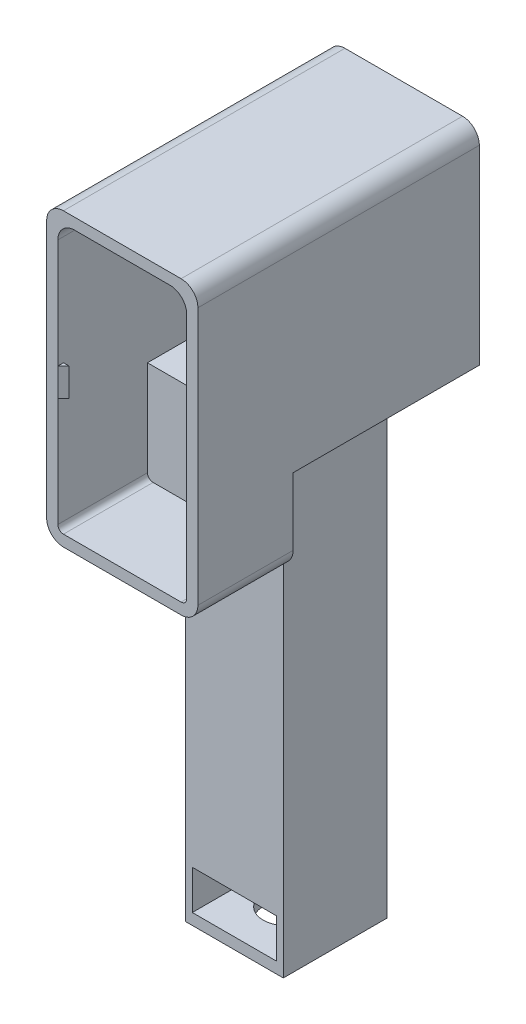
from build123d import *

# Parameters (mm, degrees)
SKETCH1_W                = 20
SKETCH1_H                = 20
SKETCH1_R                = 4
SKETCH1_H_2              = 10
BOSS_EXTRUDE2_DEPTH      = 2
SKETCH2_W                = 45
SKETCH2_H                = 60
SKETCH2_W_2              = 43
SKETCH2_H_2              = 58
BOSS_EXTRUDE3_DEPTH      = 4
SKETCH6_W                = 45
SKETCH6_H                = 30
BOSS_EXTRUDE4_DEPTH      = 2
CUT_EXTRUDE4_DEPTH       = 4
BOSS_EXTRUDE5_DEPTH      = 7
BOSS_EXTRUDE5_2_DEPTH    = 7
BOSS_EXTRUDE5_3_DEPTH    = 7
SKETCH11_W               = 19
SKETCH11_H               = 19
BOSS_EXTRUDE6_DEPTH      = 2
SKETCH14_R               = 4
CUT_EXTRUDE7_DEPTH       = 19
SKETCH15_W               = 1
SKETCH15_H               = 17
SKETCH15_H_2             = 1
BOSS_EXTRUDE7_DEPTH      = 80
SKETCH16_W               = 16.5
SKETCH16_H               = 16.5
BOSS_EXTRUDE8_DEPTH      = 80
SKETCH17_R               = 4
CUT_EXTRUDE8_DEPTH       = 193
SKETCH18_W               = 105.72576136
SKETCH18_H               = 91
CUT_EXTRUDE9_DEPTH       = 193
SKETCH19_W               = 10.5
SKETCH19_H               = 2
CUT_EXTRUDE10_DEPTH      = 193
SKETCH20_W               = 16.5
SKETCH20_H               = 16.5
SKETCH20_R               = 4
BOSS_EXTRUDE10_DEPTH     = 80
SKETCH21_W               = 16.5
SKETCH21_H               = 16.5
SKETCH21_R               = 4
CUT_EXTRUDE11_DEPTH      = 80
SKETCH22_W               = 14
SKETCH22_H               = 5
CUT_EXTRUDE12_DEPTH      = 16
SKETCH24_W               = 16.5
SKETCH24_H               = 80
SKETCH24_W_2             = 14
SKETCH24_H_2             = 5
BOSS_EXTRUDE11_DEPTH     = 2
SKETCH25_R               = 4.1
SKETCH25_R_2             = 4
CUT_EXTRUDE14_DEPTH      = 103
SKETCH26_W               = 35
SKETCH26_H               = 40
BOSS_EXTRUDE12_DEPTH     = 5
SKETCH27_W               = 23
SKETCH27_H               = 5.75
CUT_EXTRUDE17_DEPTH      = 5
SKETCH28_W               = 2
SKETCH28_H               = 40
BOSS_EXTRUDE13_DEPTH     = 32
SKETCH29_W               = 4
SKETCH29_H               = 40
CUT_EXTRUDE18_DEPTH      = 32
SKETCH30_W               = 4
SKETCH30_H               = 40
CUT_EXTRUDE19_DEPTH      = 32
SKETCH31_W               = 10
SKETCH31_H               = 2
CUT_EXTRUDE20_DEPTH      = 32
SKETCH34_W               = 44.25
SKETCH34_H               = 2
BOSS_EXTRUDE15_DEPTH     = 23
FILLET1_R                = 3
FILLET2_R                = 3
FILLET3_R                = 3
FILLET4_R                = 3
BOSS_EXTRUDE16_DEPTH     = 20
SKETCH36_W               = 10
SKETCH36_H               = 2
BOSS_EXTRUDE17_DEPTH     = 23
SKETCH37_W               = 27
SKETCH37_H               = 20
CUT_EXTRUDE23_DEPTH      = 1
SKETCH42_W               = 1
SKETCH42_H               = 5
BOSS_EXTRUDE22_DEPTH     = 2
SKETCH44_W               = 1
SKETCH44_H               = 2
BOSS_EXTRUDE23_DEPTH     = 2
SKETCH46_W               = 1
SKETCH46_H               = 2
BOSS_EXTRUDE24_DEPTH     = 3
SKETCH47_W               = 16.5
SKETCH47_H               = 18.5
SKETCH47_R               = 4.1
BOSS_EXTRUDE25_DEPTH     = 2
SKETCH50_W               = 14
SKETCH50_H               = 18
SKETCH50_R               = 4.1
CUT_EXTRUDE26_DEPTH      = 2
SKETCH51_W               = 18
SKETCH51_H               = 7
CUT_EXTRUDE27_DEPTH      = 0.5
SKETCH52_W               = 18
SKETCH52_H               = 7
CUT_EXTRUDE28_DEPTH      = 0.5
SKETCH53_W               = 18.5
SKETCH53_H               = 82
BOSS_EXTRUDE26_DEPTH     = 0.5
SKETCH54_W               = 18.5
SKETCH54_H               = 82
BOSS_EXTRUDE27_DEPTH     = 0.5
BOSS_EXTRUDE30_DEPTH     = 5
CUT_EXTRUDE31_REACH      = 138.104
SKETCH61_W               = 23
SKETCH61_H               = 5
CUT_EXTRUDE32_DEPTH      = 25
CUT_EXTRUDE32_DEPTH_BACK = 5
SKETCH62_W               = 6.75
SKETCH62_H               = 5
BOSS_EXTRUDE31_DEPTH     = 10.25
BOSS_EXTRUDE32_DEPTH     = 6
SKETCH65_W               = 23
SKETCH65_H               = 2
BOSS_EXTRUDE33_DEPTH     = 6
FILLET5_R                = 3
FILLET6_R                = 3
FILLET7_R                = 1
FILLET8_R                = 1
SKETCH66_W               = 1
SKETCH66_H               = 1
CUT_EXTRUDE33_DEPTH      = 5
BOSS_EXTRUDE34_DEPTH     = 6
SKETCH68_W               = 17
SKETCH68_H               = 15
BOSS_EXTRUDE35_DEPTH     = 6
BOSS_EXTRUDE37_DEPTH     = 15
SKETCH72_W               = 3
SKETCH72_H               = 15
BOSS_EXTRUDE38_DEPTH     = 3


# Read off the part's stored shape, not the designer's step: Boss-Extrude16, Boss-Extrude32
with BuildPart() as part:
    # Sketch1 → Boss-Extrude2 (new body)
    # profile 1 of 6: a face of its own
    with BuildSketch(Plane(origin=(0, 0, 0), x_dir=(1, 0, 0), z_dir=(0, 1, 0))):
        Polygon((-22.5, 10), (-10, 10), (10, 10), (22.5, 10), (22.5, 70), (-22.5, 70), align=None)
    # profile 2 of 6: a face of its own
    with BuildSketch(Plane(origin=(0, 0, 0), x_dir=(1, 0, 0), z_dir=(0, 1, 0))):
        Polygon((-22.5, 10), (-10, -10), (-10, 10), align=None)
    # profile 3 of 6: a face of its own
    with BuildSketch(Plane(origin=(0, 0, 0), x_dir=(1, 0, 0), z_dir=(0, 1, 0))):
        Polygon((10, 10), (10, -10), (22.5, 10), align=None)
    # profile 4 of 6: a face of its own
    with BuildSketch(Plane(origin=(0, 0, 0), x_dir=(1, 0, 0), z_dir=(0, 1, 0))):
        Rectangle(SKETCH1_W, SKETCH1_H)
        Circle(SKETCH1_R, mode=Mode.SUBTRACT)
    # profile 5 of 6: a face of its own
    with BuildSketch(Plane(origin=(0, 0, 0), x_dir=(1, 0, 0), z_dir=(0, 1, 0))):
        Circle(SKETCH1_R)
    # profile 6 of 6: a face of its own
    with BuildSketch(Plane(origin=(0, 0, 0), x_dir=(1, 0, 0), z_dir=(0, 1, 0))):
        with Locations((0, -15)):
            Rectangle(SKETCH1_W, SKETCH1_H_2)
    extrude(amount=BOSS_EXTRUDE2_DEPTH)

    # Sketch2 → Boss-Extrude3 (add)
    with BuildSketch(Plane(origin=(0, 2, 0), x_dir=(1, 0, 0), z_dir=(0, 1, 0))):
        with Locations((0, 40)):
            Rectangle(SKETCH2_W, SKETCH2_H)
        with Locations((0, 40)):
            Rectangle(SKETCH2_W_2, SKETCH2_H_2, mode=Mode.SUBTRACT)
    extrude(amount=BOSS_EXTRUDE3_DEPTH)

    # Sketch6 → Boss-Extrude4 (add)
    with BuildSketch(Plane(origin=(0, 2, 0), x_dir=(1, 0, 0), z_dir=(0, 1, 0))):
        with Locations((0, -5)):
            Rectangle(SKETCH6_W, SKETCH6_H)
    extrude(amount=-BOSS_EXTRUDE4_DEPTH)

    # Sketch7 → Cut-Extrude4 (cut)
    with BuildSketch(Plane(origin=(0, 2, 0), x_dir=(1, 0, 0), z_dir=(0, 1, 0))):
        with BuildLine():
            Line((9.5, 9.5), (-9.5, 9.5))
            Line((-9.5, 9.5), (-9.5, 2.122498999))
            ThreePointArc((-9.5, 2.122498999), (0, 9), (9.5, 2.122498999))
            Line((9.5, 2.122498999), (9.5, 9.5))
        make_face()
        with BuildLine():
            ThreePointArc((-5.267826876, -9.5), (-7.858215886, -7.184532568), (-9.5, -4.122498999))
            Line((-9.5, -4.122498999), (-9.5, -9.5))
            Line((-9.5, -9.5), (-5.267826876, -9.5))
        make_face()
        with BuildLine():
            Line((9.5, -9.5), (9.5, -4.122498999))
            ThreePointArc((9.5, -4.122498999), (7.858215886, -7.184532568), (5.267826876, -9.5))
            Line((5.267826876, -9.5), (9.5, -9.5))
        make_face()
    extrude(amount=-CUT_EXTRUDE4_DEPTH, mode=Mode.SUBTRACT)


with BuildPart() as body_2:
    # Sketch8 → Boss-Extrude5 (new body)
    with BuildSketch(Plane(origin=(0, 2, 0), x_dir=(1, 0, 0), z_dir=(0, 1, 0))):
        with BuildLine():
            Line((9.5, 2.122498999), (9.5, 9.5))
            Line((9.5, 9.5), (-9.5, 9.5))
            Line((-9.5, 9.5), (-9.5, 2.122498999))
            ThreePointArc((-9.5, 2.122498999), (0, 9), (9.5, 2.122498999))
        make_face()
    extrude(amount=BOSS_EXTRUDE5_DEPTH)



with BuildPart() as body_3:
    # Sketch8 → Boss-Extrude5 2 (new body)
    with BuildSketch(Plane(origin=(0, 2, 0), x_dir=(1, 0, 0), z_dir=(0, 1, 0))):
        with BuildLine():
            Line((-9.5, -9.5), (-5.267826876, -9.5))
            ThreePointArc((-5.267826876, -9.5), (-7.858215886, -7.184532568), (-9.5, -4.122498999))
            Line((-9.5, -4.122498999), (-9.5, -9.5))
        make_face()
    extrude(amount=BOSS_EXTRUDE5_2_DEPTH)


with BuildPart() as body_4:
    # Sketch8 → Boss-Extrude5 3 (new body)
    with BuildSketch(Plane(origin=(0, 2, 0), x_dir=(1, 0, 0), z_dir=(0, 1, 0))):
        with BuildLine():
            Line((9.5, -9.5), (9.5, -4.122498999))
            ThreePointArc((9.5, -4.122498999), (7.858215886, -7.184532568), (5.267826876, -9.5))
            Line((5.267826876, -9.5), (9.5, -9.5))
        make_face()
    extrude(amount=BOSS_EXTRUDE5_3_DEPTH)


with BuildPart() as body_2_1:
    add(body_2.part)

    add(body_3.part)  # Boss-Extrude6 merges body 3

    add(body_4.part)  # Boss-Extrude6 merges body 4
    # Sketch11 → Boss-Extrude6 (add)
    with BuildSketch(Plane(origin=(0, 9, 0), x_dir=(1, 0, 0), z_dir=(0, 1, 0))):
        Rectangle(SKETCH11_W, SKETCH11_H)
    extrude(amount=BOSS_EXTRUDE6_DEPTH)


with BuildPart() as cut_extrude7_tool:
    # Sketch14 → Cut-Extrude7 (new body)
    with BuildSketch(Plane.XZ):
        with Locations(Location((0, 1, 0), (0, 0, 270))):
            Circle(SKETCH14_R)
    extrude(amount=-CUT_EXTRUDE7_DEPTH)


with BuildPart() as part_1:
    add(part.part)

    # Cut-Extrude7: cut by cut_extrude7_tool
    add(cut_extrude7_tool.part, mode=Mode.SUBTRACT)


with BuildPart() as body_2_2:
    add(body_2_1.part)

    # Cut-Extrude7: cut by cut_extrude7_tool
    add(cut_extrude7_tool.part, mode=Mode.SUBTRACT)

    # Sketch15 → Boss-Extrude7 (add)
    with BuildSketch(Plane(origin=(0, 11, 0), x_dir=(1, 0, 0), z_dir=(0, 1, 0))):
        Polygon((-8.5, 8.5), (8.5, 8.5), (8.5, 9.5), (-9.5, 9.5), (-9.5, -9.5), (8.5, -9.5), (8.5, -8.5), (-8.5, -8.5), align=None)
        with Locations((9, 0)):
            Rectangle(SKETCH15_W, SKETCH15_H)
        with Locations((9, 9)):
            Rectangle(SKETCH15_W, SKETCH15_H_2)
        with Locations((9, -9)):
            Rectangle(SKETCH15_W, SKETCH15_H_2)
    extrude(amount=BOSS_EXTRUDE7_DEPTH)


with BuildPart() as body_3_2:
    # Sketch16 → Boss-Extrude8 (new body)
    with BuildSketch(Plane(origin=(0, 91, 0), x_dir=(1, 0, 0), z_dir=(0, 1, 0))):
        Rectangle(SKETCH16_W, SKETCH16_H)
    extrude(amount=BOSS_EXTRUDE8_DEPTH)

    # Sketch17 → Cut-Extrude8 (cut)
    with BuildSketch(Plane.XZ):
        with Locations(Location((0, 1, 0), (0, 0, 270))):
            Circle(SKETCH17_R)
    extrude(amount=-CUT_EXTRUDE8_DEPTH, mode=Mode.SUBTRACT)

    # Sketch20 → Boss-Extrude10 (add)
    with BuildSketch(Plane.XZ.offset(-91)):
        Rectangle(SKETCH20_W, SKETCH20_H)
        with Locations(Location((0, 1, 0), (0, 0, 270))):
            Circle(SKETCH20_R, mode=Mode.SUBTRACT)
    extrude(amount=BOSS_EXTRUDE10_DEPTH)

    # Sketch21 → Cut-Extrude11 (cut)
    with BuildSketch(Plane(origin=(0, 171, 0), x_dir=(1, 0, 0), z_dir=(0, 1, 0))):
        Rectangle(SKETCH21_W, SKETCH21_H)
        with Locations(Location((0, -1, 0), (0, 0, 90))):
            Circle(SKETCH21_R, mode=Mode.SUBTRACT)
    extrude(amount=-CUT_EXTRUDE11_DEPTH, mode=Mode.SUBTRACT)

    # Sketch22 → Cut-Extrude12 (cut)
    with BuildSketch(Plane.XY.offset(8.25)):
        with Locations((0, 15.5)):
            Rectangle(SKETCH22_W, SKETCH22_H)
    extrude(amount=-CUT_EXTRUDE12_DEPTH, mode=Mode.SUBTRACT)

    # Sketch24 → Boss-Extrude11 (add)
    with BuildSketch(Plane.XY.offset(8.25)):
        with Locations((0, 51)):
            Rectangle(SKETCH24_W, SKETCH24_H)
        with Locations((0, 15.5)):
            Rectangle(SKETCH24_W_2, SKETCH24_H_2, mode=Mode.SUBTRACT)
    extrude(amount=BOSS_EXTRUDE11_DEPTH)

    # Sketch25 → Cut-Extrude14 (cut)
    with BuildSketch(Plane(origin=(0, 91, 0), x_dir=(1, 0, 0), z_dir=(0, 1, 0))):
        with Locations(Location((0, -1, 0), (0, 0, 270))):
            Circle(SKETCH25_R)
        with Locations((0, -1)):
            Circle(SKETCH25_R_2, mode=Mode.SUBTRACT)
    extrude(amount=-CUT_EXTRUDE14_DEPTH, mode=Mode.SUBTRACT)

    # Sketch26 → Boss-Extrude12 (add)
    with BuildSketch(Plane(origin=(0, 91, 0), x_dir=(1, 0, 0), z_dir=(0, 1, 0))):
        Rectangle(SKETCH26_W, SKETCH26_H)
    extrude(amount=BOSS_EXTRUDE12_DEPTH)

    # Sketch27 → Cut-Extrude17 (cut)
    with BuildSketch(Plane(origin=(0, 96, 0), x_dir=(1, 0, 0), z_dir=(0, 1, 0))):
        with Locations((0, -17.125)):
            Rectangle(SKETCH27_W, SKETCH27_H)
    extrude(amount=-CUT_EXTRUDE17_DEPTH, mode=Mode.SUBTRACT)

    # Sketch28 → Boss-Extrude13 (add)
    with BuildSketch(Plane(origin=(0, 96, 0), x_dir=(1, 0, 0), z_dir=(0, 1, 0))):
        with Locations((12.5, 0)):
            Rectangle(SKETCH28_W, SKETCH28_H)
        with Locations((-12.5, 0)):
            Rectangle(SKETCH28_W, SKETCH28_H)
    extrude(amount=BOSS_EXTRUDE13_DEPTH)

    # Sketch29 → Cut-Extrude18 (cut)
    with BuildSketch(Plane(origin=(0, 96, 0), x_dir=(1, 0, 0), z_dir=(0, 1, 0))):
        with Locations((-15.5, 0)):
            Rectangle(SKETCH29_W, SKETCH29_H)
    extrude(amount=-CUT_EXTRUDE18_DEPTH, mode=Mode.SUBTRACT)

    # Sketch30 → Cut-Extrude19 (cut)
    with BuildSketch(Plane(origin=(0, 96, 0), x_dir=(1, 0, 0), z_dir=(0, 1, 0))):
        with Locations((15.5, 0)):
            Rectangle(SKETCH30_W, SKETCH30_H)
    extrude(amount=-CUT_EXTRUDE19_DEPTH, mode=Mode.SUBTRACT)

    # Sketch31 → Cut-Extrude20 (cut)
    with BuildSketch(Plane(origin=(0, 96, 0), x_dir=(1, 0, 0), z_dir=(0, 1, 0))):
        with Locations((0, 19)):
            Rectangle(SKETCH31_W, SKETCH31_H)
    extrude(amount=-CUT_EXTRUDE20_DEPTH, mode=Mode.SUBTRACT)

    # Sketch34 → Boss-Extrude15 (add)
    with BuildSketch(Plane.ZY.offset(-11.5)):
        with Locations((2.125, 127)):
            Rectangle(SKETCH34_W, SKETCH34_H)
    extrude(amount=BOSS_EXTRUDE15_DEPTH)

    # Fillet1
    fillet1_edges = [body_3_2.edges().sort_by_distance(p)[0] for p in [
        (-13.5, 128, 0),
    ]]
    fillet(fillet1_edges, radius=FILLET1_R)

    # Fillet2
    fillet2_edges = [body_3_2.edges().sort_by_distance(p)[0] for p in [
        (13.5, 128, 0),
    ]]
    fillet(fillet2_edges, radius=FILLET2_R)

    # Fillet3
    # the kernel refuses this fillet: 3 mm, written as the material it adds along each edge
    with BuildSketch(Plane(origin=(-11.5, 126, 27.5), x_dir=(1, 0, 0), z_dir=(0, 0, -1))) as fillet3_piece_1_section:
        with BuildLine():
            CenterArc((FILLET3_R, FILLET3_R), FILLET3_R, 180, 90)
            Line((0, FILLET3_R), (0, 0))
            Line((0, 0), (FILLET3_R, 0))
        make_face()
    fillet3_piece_1 = extrude(amount=47.5, mode=Mode.PRIVATE)
    fillet3_piece_1 = split(fillet3_piece_1, bisect_by=Plane(origin=(-10.759146849, 125.389580611, 24.25), z_dir=(0, 0, -1)), keep=Keep.TOP, mode=Mode.PRIVATE)
    fillet3_piece_1 = split(fillet3_piece_1, bisect_by=Plane(origin=(-11.5, 125.389580611, 22.125), z_dir=(1, 0, 0)), keep=Keep.TOP, mode=Mode.PRIVATE)
    fillet3_piece_1 = split(fillet3_piece_1, bisect_by=Plane(origin=(-10.759146849, 125.389580611, 20), z_dir=(0, 0, 1)), keep=Keep.TOP, mode=Mode.PRIVATE)
    add(fillet3_piece_1)
    with BuildSketch(Plane(origin=(-11.5, 126, 20), x_dir=(1, 0, 0), z_dir=(0, 0, -1))) as fillet3_piece_2_section:
        with BuildLine():
            CenterArc((FILLET3_R, FILLET3_R), FILLET3_R, 180, 90)
            Line((0, FILLET3_R), (0, 0))
            Line((0, 0), (FILLET3_R, 0))
        make_face()
    fillet3_piece_2 = extrude(amount=40, mode=Mode.PRIVATE)
    fillet3_piece_2 = split(fillet3_piece_2, bisect_by=Plane(origin=(-11.5, 125.389580611, 0), z_dir=(1, 0, 0)), keep=Keep.TOP, mode=Mode.PRIVATE)
    add(fillet3_piece_2)

    # Fillet4
    # the kernel refuses this fillet: 3 mm, written as the material it adds along each edge
    with BuildSketch(Plane(origin=(11.5, 126, 27.5), x_dir=(0, -1, 0), z_dir=(0, 0, -1))) as fillet4_piece_1_section:
        with BuildLine():
            CenterArc((FILLET4_R, FILLET4_R), FILLET4_R, 180, 90)
            Line((0, FILLET4_R), (0, 0))
            Line((0, 0), (FILLET4_R, 0))
        make_face()
    fillet4_piece_1 = extrude(amount=47.5, mode=Mode.PRIVATE)
    fillet4_piece_1 = split(fillet4_piece_1, bisect_by=Plane(origin=(10.759146849, 125.389580611, 20), z_dir=(0, 0, 1)), keep=Keep.TOP, mode=Mode.PRIVATE)
    fillet4_piece_1 = split(fillet4_piece_1, bisect_by=Plane(origin=(11.5, 125.389580611, 22.125), z_dir=(-1, 0, 0)), keep=Keep.TOP, mode=Mode.PRIVATE)
    fillet4_piece_1 = split(fillet4_piece_1, bisect_by=Plane(origin=(10.759146849, 125.389580611, 24.25), z_dir=(0, 0, -1)), keep=Keep.TOP, mode=Mode.PRIVATE)
    add(fillet4_piece_1)
    with BuildSketch(Plane(origin=(11.5, 126, 20), x_dir=(0, -1, 0), z_dir=(0, 0, -1))) as fillet4_piece_2_section:
        with BuildLine():
            CenterArc((FILLET4_R, FILLET4_R), FILLET4_R, 180, 90)
            Line((0, FILLET4_R), (0, 0))
            Line((0, 0), (FILLET4_R, 0))
        make_face()
    fillet4_piece_2 = extrude(amount=40, mode=Mode.PRIVATE)
    fillet4_piece_2 = split(fillet4_piece_2, bisect_by=Plane(origin=(11.5, 125.389580611, 0), z_dir=(-1, 0, 0)), keep=Keep.TOP, mode=Mode.PRIVATE)
    add(fillet4_piece_2)

    # Boss-Extrude16 outline → Boss-Extrude16 (add)
    with BuildSketch(Plane.XZ.offset(-91)):
        Polygon((11.5, 20), (11.5, 14.25), (-11.5, 14.25), (-11.5, 20), (-13.5, 20), (-13.5, 12.25), (13.5, 12.25), (13.5, 20), align=None)
    extrude(amount=BOSS_EXTRUDE16_DEPTH)

    # Sketch36 → Boss-Extrude17 (add)
    with BuildSketch(Plane.ZY.offset(-11.5)):
        with Locations((19.25, 72)):
            Rectangle(SKETCH36_W, SKETCH36_H)
    extrude(amount=BOSS_EXTRUDE17_DEPTH)

    # Sketch37 → Cut-Extrude23 (cut)
    with BuildSketch(Plane(origin=(0, 0, 12.25), x_dir=(-1, 0, 0), z_dir=(0, 0, -1))):
        with Locations((0, 81)):
            Rectangle(SKETCH37_W, SKETCH37_H)
    extrude(amount=-CUT_EXTRUDE23_DEPTH, mode=Mode.SUBTRACT)

    # Sketch47 → Boss-Extrude25 (add)
    with BuildSketch(Plane.XZ.offset(-11)):
        with Locations((0, 1)):
            Rectangle(SKETCH47_W, SKETCH47_H)
        with Locations(Location((0, 1, 0), (0, 0, 90))):
            Circle(SKETCH47_R, mode=Mode.SUBTRACT)
    extrude(amount=BOSS_EXTRUDE25_DEPTH)

    # Sketch50 → Cut-Extrude26 (cut)
    with BuildSketch(Plane(origin=(0, 13, 0), x_dir=(1, 0, 0), z_dir=(0, 1, 0))):
        with Locations((0, -1.25)):
            Rectangle(SKETCH50_W, SKETCH50_H)
        with Locations(Location((0, -1, 0), (0, 0, 270))):
            Circle(SKETCH50_R, mode=Mode.SUBTRACT)
    extrude(amount=-CUT_EXTRUDE26_DEPTH, mode=Mode.SUBTRACT)

    # Sketch51 → Cut-Extrude27 (cut)
    with BuildSketch(Plane(origin=(-7, 0, 0), x_dir=(0, 0, -1), z_dir=(1, 0, 0))):
        with Locations((-1.25, 14.5)):
            Rectangle(SKETCH51_W, SKETCH51_H)
    extrude(amount=-CUT_EXTRUDE27_DEPTH, mode=Mode.SUBTRACT)

    # Sketch52 → Cut-Extrude28 (cut)
    with BuildSketch(Plane.ZY.offset(-7)):
        with Locations((1.25, 14.5)):
            Rectangle(SKETCH52_W, SKETCH52_H)
    extrude(amount=-CUT_EXTRUDE28_DEPTH, mode=Mode.SUBTRACT)

    # Sketch53 → Boss-Extrude26 (add)
    with BuildSketch(Plane.ZY.offset(8.25)):
        with Locations((1, 50)):
            Rectangle(SKETCH53_W, SKETCH53_H)
    extrude(amount=BOSS_EXTRUDE26_DEPTH)

    # Sketch54 → Boss-Extrude27 (add)
    with BuildSketch(Plane(origin=(8.25, 0, 0), x_dir=(0, 0, -1), z_dir=(1, 0, 0))):
        with Locations((-1, 50)):
            Rectangle(SKETCH54_W, SKETCH54_H)
    extrude(amount=BOSS_EXTRUDE27_DEPTH)

    # Sketch59 → Boss-Extrude30 (add)
    with BuildSketch(Plane(origin=(0, 73, 0), x_dir=(1, 0, 0), z_dir=(0, 1, 0))):
        Polygon((-11.5, -20), (-11.5, -24.25), (11.5, -24.25), (11.5, -20), (11.5, -14.25), (-11.5, -14.25), align=None)
    extrude(amount=BOSS_EXTRUDE30_DEPTH)

    # Cut-Extrude31: up to this face of the body (flat: up to its plane)
    cut_extrude31_end = Plane(body_3_2.part.faces().sort_by_distance((0, 81, 13.25))[0])
    # Sketch61 → Cut-Extrude31 (cut, up to the picked face)
    with BuildSketch(Plane.XY.offset(24.25), mode=Mode.PRIVATE) as cut_extrude31_sk1:
        with Locations((0, 73.5)):
            Rectangle(SKETCH61_W, SKETCH61_H)
    cut_extrude31_tool1 = split(extrude(cut_extrude31_sk1.sketch, amount=-CUT_EXTRUDE31_REACH, mode=Mode.PRIVATE), bisect_by=cut_extrude31_end, keep=Keep.BOTH, mode=Mode.PRIVATE)
    add(cut_extrude31_tool1.solids().sort_by(Axis((0, 73.5, 24.25), (0, 0, -1)))[0], mode=Mode.SUBTRACT)

    # Sketch62 → Cut-Extrude32 (cut, two sides: drawn at the far end of the back side and taken through both)
    with BuildSketch(Plane(origin=(-11.5, 0, 0), x_dir=(0, 0, -1), z_dir=(1, 0, 0)).offset(-CUT_EXTRUDE32_DEPTH_BACK)):
        with Locations((-16.625, 73.5)):
            Rectangle(SKETCH62_W, SKETCH62_H)
    extrude(amount=CUT_EXTRUDE32_DEPTH + CUT_EXTRUDE32_DEPTH_BACK, mode=Mode.SUBTRACT)



with BuildPart() as cut_extrude9_tool:
    # Sketch18 → Cut-Extrude9 (new body)
    with BuildSketch(Plane.ZY.offset(22.5)):
        with Locations((-43.36288068, 45.5)):
            Rectangle(SKETCH18_W, SKETCH18_H)
    extrude(amount=-CUT_EXTRUDE9_DEPTH)


with BuildPart() as part_2:
    add(part_1.part)

    # Cut-Extrude9: cut by cut_extrude9_tool
    add(cut_extrude9_tool.part, mode=Mode.SUBTRACT)

    # Sketch19 → Cut-Extrude10 (cut)
    with BuildSketch(Plane.ZY.offset(22.5)):
        with Locations((14.75, 1)):
            Rectangle(SKETCH19_W, SKETCH19_H)
    extrude(amount=-CUT_EXTRUDE10_DEPTH, mode=Mode.SUBTRACT)


with BuildPart() as body_2_3:
    add(body_2_2.part)

    # Cut-Extrude9: cut by cut_extrude9_tool
    add(cut_extrude9_tool.part, mode=Mode.SUBTRACT)


with BuildPart() as body_2_2_1:
    # Sketch42 → Boss-Extrude22 (new body)
    with BuildSketch(Plane.XY.offset(30.25)):
        with Locations((-11, 101)):
            Rectangle(SKETCH42_W, SKETCH42_H)
    extrude(amount=-BOSS_EXTRUDE22_DEPTH)


with BuildPart() as body_3_3:
    # Sketch44 → Boss-Extrude23 (new body)
    with BuildSketch(Plane.XY.offset(30.25)):
        with Locations((11, 99.5)):
            Rectangle(SKETCH44_W, SKETCH44_H)
    extrude(amount=-BOSS_EXTRUDE23_DEPTH)

    # Sketch46 → Boss-Extrude24 (add)
    with BuildSketch(Plane(origin=(0, 100.5, 0), x_dir=(1, 0, 0), z_dir=(0, 1, 0))):
        with Locations((11, -29.25)):
            Rectangle(SKETCH46_W, SKETCH46_H)
    extrude(amount=BOSS_EXTRUDE24_DEPTH)


with BuildPart() as body_3_2_1:
    add(body_3_2.part)

    add(body_2_2_1.part)  # Boss-Extrude31 merges body 2 2

    add(body_3_3.part)  # Boss-Extrude31 merges body 3 3
    # Sketch63 → Boss-Extrude31 (add)
    with BuildSketch(Plane.XY.offset(20)):
        with BuildLine():
            Line((-13.5, 76), (-11.5, 76))
            Line((-11.5, 76), (-11.5, 78))
            Line((-11.5, 78), (-11.5, 123))
            Line((-11.5, 123), (-11.5, 127.828427125))
            ThreePointArc((-11.5, 127.828427125), (-12.949489743, 126.732050808), (-13.5, 125))
            Line((-13.5, 125), (-13.5, 76))
        make_face()
        with BuildLine():
            Line((11.5, 76), (13.5, 76))
            Line((13.5, 76), (13.5, 125))
            ThreePointArc((13.5, 125), (12.949489743, 126.732050808), (11.5, 127.828427125))
            Line((11.5, 127.828427125), (11.5, 123))
            Line((11.5, 123), (11.5, 78))
            Line((11.5, 78), (11.5, 76))
        make_face()
    extrude(amount=BOSS_EXTRUDE31_DEPTH)

    # Boss-Extrude32 outline → Boss-Extrude32 (add)
    with BuildSketch(Plane.XY.offset(24.25)):
        with BuildLine():
            ThreePointArc((-10.5, 128), (-11.007305936, 127.956795679), (-11.5, 127.828427125))
            Line((-11.5, 127.828427125), (-11.5, 123))
            ThreePointArc((-11.5, 123), (-10.621320344, 125.121320344), (-8.5, 126))
            Line((-8.5, 126), (8.5, 126))
            ThreePointArc((8.5, 126), (10.621320344, 125.121320344), (11.5, 123))
            Line((11.5, 123), (11.5, 127.828427125))
            ThreePointArc((11.5, 127.828427125), (11.007305936, 127.956795679), (10.5, 128))
            Line((10.5, 128), (-10.5, 128))
        make_face()
    extrude(amount=BOSS_EXTRUDE32_DEPTH)

    # Sketch65 → Boss-Extrude33 (add)
    with BuildSketch(Plane.XY.offset(24.25)):
        with Locations((0, 77)):
            Rectangle(SKETCH65_W, SKETCH65_H)
    extrude(amount=BOSS_EXTRUDE33_DEPTH)

    # Fillet5
    fillet5_edges = [body_3_2_1.edges().sort_by_distance(p)[0] for p in [
        (13.5, 76, 21.75),
    ]]
    fillet(fillet5_edges, radius=FILLET5_R)

    # Fillet6
    fillet6_edges = [body_3_2_1.edges().sort_by_distance(p)[0] for p in [
        (-13.5, 76, 21.75),
    ]]
    fillet(fillet6_edges, radius=FILLET6_R)

    # Fillet7
    fillet7_edges = [body_3_2_1.edges().sort_by_distance(p)[0] for p in [
        (-11.5, 78, 22.25),
    ]]
    fillet(fillet7_edges, radius=FILLET7_R)

    # Fillet8
    fillet8_edges = [body_3_2_1.edges().sort_by_distance(p)[0] for p in [
        (11.5, 78, 22.25),
    ]]
    fillet(fillet8_edges, radius=FILLET8_R)

    # Sketch66 → Cut-Extrude33 (cut)
    with BuildSketch(Plane(origin=(0, 103.5, 0), x_dir=(1, 0, 0), z_dir=(0, 1, 0))):
        with Locations((-11, -28.75)):
            Rectangle(SKETCH66_W, SKETCH66_H)
        Polygon((-10.5, -29.25), (-10.5, -30.25), (-11.5, -30.25), align=None)
        Polygon((11.5, -30.25), (10.5, -29.25), (10.5, -30.25), align=None)
        with Locations((11, -28.75)):
            Rectangle(SKETCH66_W, SKETCH66_H)
    extrude(amount=-CUT_EXTRUDE33_DEPTH, mode=Mode.SUBTRACT)

    # Sketch67 → Boss-Extrude34 (add)
    with BuildSketch(Plane(origin=(0, 96, 0), x_dir=(1, 0, 0), z_dir=(0, 1, 0))):
        Polygon((5, 5), (5, 18), (-5, 18), (-5, 20), (-11.5, 20), (-11.5, 5), align=None)
        Polygon((11.5, 20), (5, 20), (5, 18), (5, 5), (11.5, 5), align=None)
    extrude(amount=BOSS_EXTRUDE34_DEPTH)

    # Sketch68 → Boss-Extrude35 (add)
    with BuildSketch(Plane.XZ.offset(-126)):
        with Locations((0, -12.5)):
            Rectangle(SKETCH68_W, SKETCH68_H)
    extrude(amount=BOSS_EXTRUDE35_DEPTH)

    # Sketch71 → Boss-Extrude37 (add)
    with BuildSketch(Plane(origin=(0, 0, -20), x_dir=(-1, 0, 0), z_dir=(0, 0, -1))):
        with BuildLine():
            ThreePointArc((-8.5, 126), (-10.621320344, 125.121320344), (-11.5, 123))
            Line((-11.5, 123), (-8.5, 123))
            Line((-8.5, 123), (-8.5, 126))
        make_face()
        with BuildLine():
            Line((8.5, 123), (11.5, 123))
            ThreePointArc((11.5, 123), (10.621320344, 125.121320344), (8.5, 126))
            Line((8.5, 126), (8.5, 123))
        make_face()
    extrude(amount=-BOSS_EXTRUDE37_DEPTH)

    # Sketch72 → Boss-Extrude38 (add)
    with BuildSketch(Plane.XZ.offset(-123)):
        with Locations((-10, -12.5)):
            Rectangle(SKETCH72_W, SKETCH72_H)
        with Locations((10, -12.5)):
            Rectangle(SKETCH72_W, SKETCH72_H)
    extrude(amount=BOSS_EXTRUDE38_DEPTH)


solid = body_3_2_1.part
